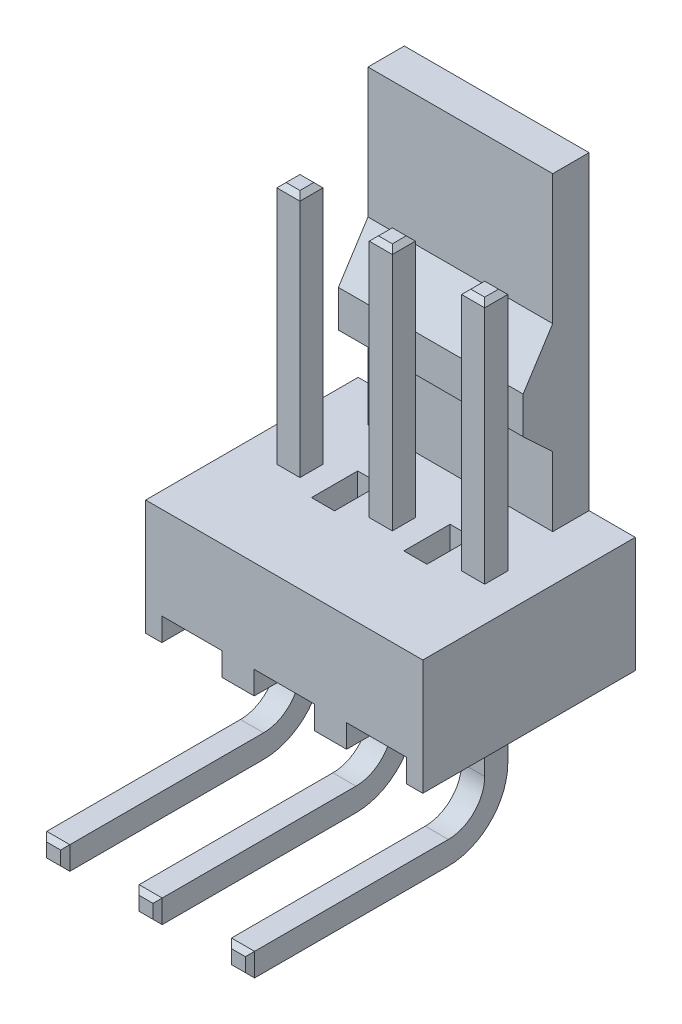
from build123d import *

# Parameters (mm, degrees)
SKETCH1_W            = 6.35
SKETCH1_H            = 5.842
BOSS_EXTRUDE1_DEPTH  = 3.175
BOSS_EXTRUDE2_DEPTH  = 5.08
SKETCH3_W            = 5.842
SKETCH3_H            = 3.175
BOSS_EXTRUDE3_DEPTH  = 1.27
SKETCH4_W            = 1.651
SKETCH4_H            = 0.635
CUT_EXTRUDE1_DEPTH   = 13.284450344
SKETCH5_W            = 0.635
SKETCH5_H            = 0.635
BOSS_EXTRUDE4_DEPTH  = 3.6725
SKETCH6_W            = 0.635
SKETCH6_H            = 0.635
BOSS_EXTRUDE5_DEPTH  = 6.4543
SKETCH7_W            = 1.651
SKETCH7_H            = 0.635
CUT_EXTRUDE2_DEPTH   = 15.482642033
SKETCH8_W            = 0.635
SKETCH8_H            = 0.635
BOSS_EXTRUDE6_DEPTH  = 3.6725
SKETCH9_W            = 0.635
SKETCH9_H            = 0.635
BOSS_EXTRUDE7_DEPTH  = 6.4543
SKETCH10_W           = 1.651
SKETCH10_H           = 0.635
CUT_EXTRUDE3_DEPTH   = 15.482642033
SKETCH11_W           = 0.635
SKETCH11_H           = 0.635
BOSS_EXTRUDE8_DEPTH  = 3.6725
SKETCH12_W           = 0.635
SKETCH12_H           = 0.635
BOSS_EXTRUDE9_DEPTH  = 6.4543
SKETCH13_W           = 0.635
SKETCH13_H           = 0.635
BOSS_EXTRUDE10_DEPTH = 6.71
SKETCH14_W           = 0.635
SKETCH14_H           = 0.635
BOSS_EXTRUDE11_DEPTH = 6.71
SKETCH15_W           = 0.635
SKETCH15_H           = 0.635
BOSS_EXTRUDE12_DEPTH = 6.71
SKETCH16_W           = 0.635
SKETCH16_H           = 1.27
CUT_EXTRUDE4_DEPTH   = 1.27
SKETCH17_W           = 0.635
SKETCH17_H           = 1.27
CUT_EXTRUDE5_DEPTH   = 1.27
CHAMFER1_SIZE        = 0.127
CHAMFER2_SIZE        = 0.753913762
CHAMFER2_SIZE2       = 0.55706549
FILLET1_R            = 1
FILLET2_R            = 1.635


with BuildPart() as part:
    # Sketch1 → Boss-Extrude1 (new body)
    with BuildSketch(Plane.XZ.offset(1.5875)):
        with Locations((-0.635, 0.0508)):
            Rectangle(SKETCH1_W, SKETCH1_H)
    extrude(amount=-BOSS_EXTRUDE1_DEPTH)

    # Sketch2 → Boss-Extrude2 (add)
    with BuildSketch(Plane(origin=(2.54, 0, 0), x_dir=(0, 0, -1), z_dir=(1, 0, 0))):
        Polygon((0.651, 4.6355), (1.8702, 3.4925), (1.8702, 1.5875), (2.8702, 1.5875), (2.8702, 10.1125), (1.8702, 10.1125), (1.8702, 6.5405), align=None)
    extrude(amount=-BOSS_EXTRUDE2_DEPTH)

    # Sketch3 → Boss-Extrude3 (add)
    with BuildSketch(Plane(origin=(2.54, 0, 0), x_dir=(0, 0, -1), z_dir=(1, 0, 0))):
        with Locations((-0.0508, 0)):
            Rectangle(SKETCH3_W, SKETCH3_H)
    extrude(amount=BOSS_EXTRUDE3_DEPTH)

    # Sketch4 → Cut-Extrude1 (cut, through all)
    with BuildSketch(Plane(origin=(0, 0, -2.8702), x_dir=(-1, 0, 0), z_dir=(0, 0, -1))):
        with Locations((0, -1.27)):
            Rectangle(SKETCH4_W, SKETCH4_H)
    extrude(amount=-CUT_EXTRUDE1_DEPTH, mode=Mode.SUBTRACT)

    # Sketch5 → Boss-Extrude4 (add)
    with BuildSketch(Plane.XZ.offset(0.9525)):
        Rectangle(SKETCH5_W, SKETCH5_H)
    extrude(amount=BOSS_EXTRUDE4_DEPTH)

    # Sketch6 → Boss-Extrude5 (add)
    with BuildSketch(Plane.XY.offset(0.3175)):
        with Locations((0, -4.3075)):
            Rectangle(SKETCH6_W, SKETCH6_H)
    extrude(amount=BOSS_EXTRUDE5_DEPTH)

    # Sketch7 → Cut-Extrude2 (cut, through all)
    with BuildSketch(Plane(origin=(0, 0, -2.8702), x_dir=(-1, 0, 0), z_dir=(0, 0, -1))):
        with Locations((2.54, -1.27)):
            Rectangle(SKETCH7_W, SKETCH7_H)
    extrude(amount=-CUT_EXTRUDE2_DEPTH, mode=Mode.SUBTRACT)

    # Sketch8 → Boss-Extrude6 (add)
    with BuildSketch(Plane.XZ.offset(0.9525)):
        with Locations((-2.54, 0)):
            Rectangle(SKETCH8_W, SKETCH8_H)
    extrude(amount=BOSS_EXTRUDE6_DEPTH)

    # Sketch9 → Boss-Extrude7 (add)
    with BuildSketch(Plane.XY.offset(0.3175)):
        with Locations((-2.54, -4.3075)):
            Rectangle(SKETCH9_W, SKETCH9_H)
    extrude(amount=BOSS_EXTRUDE7_DEPTH)

    # Sketch10 → Cut-Extrude3 (cut, through all)
    with BuildSketch(Plane(origin=(0, 0, -2.8702), x_dir=(-1, 0, 0), z_dir=(0, 0, -1))):
        with Locations((-2.54, -1.27)):
            Rectangle(SKETCH10_W, SKETCH10_H)
    extrude(amount=-CUT_EXTRUDE3_DEPTH, mode=Mode.SUBTRACT)

    # Sketch11 → Boss-Extrude8 (add)
    with BuildSketch(Plane.XZ.offset(0.9525)):
        with Locations((2.54, 0)):
            Rectangle(SKETCH11_W, SKETCH11_H)
    extrude(amount=BOSS_EXTRUDE8_DEPTH)

    # Sketch12 → Boss-Extrude9 (add)
    with BuildSketch(Plane.XY.offset(0.3175)):
        with Locations((2.54, -4.3075)):
            Rectangle(SKETCH12_W, SKETCH12_H)
    extrude(amount=BOSS_EXTRUDE9_DEPTH)

    # Sketch13 → Boss-Extrude10 (add)
    with BuildSketch(Plane(origin=(0, 1.5875, 0), x_dir=(-1, 0, 0), z_dir=(0, 1, 0))):
        with Locations((-2.54, 0)):
            Rectangle(SKETCH13_W, SKETCH13_H)
    extrude(amount=BOSS_EXTRUDE10_DEPTH)

    # Sketch14 → Boss-Extrude11 (add)
    with BuildSketch(Plane(origin=(0, 1.5875, 0), x_dir=(-1, 0, 0), z_dir=(0, 1, 0))):
        Rectangle(SKETCH14_W, SKETCH14_H)
    extrude(amount=BOSS_EXTRUDE11_DEPTH)

    # Sketch15 → Boss-Extrude12 (add)
    with BuildSketch(Plane(origin=(0, 1.5875, 0), x_dir=(-1, 0, 0), z_dir=(0, 1, 0))):
        with Locations((2.54, 0)):
            Rectangle(SKETCH15_W, SKETCH15_H)
    extrude(amount=BOSS_EXTRUDE12_DEPTH)

    # Sketch16 → Cut-Extrude4 (cut)
    with BuildSketch(Plane(origin=(0, 1.5875, 0), x_dir=(-1, 0, 0), z_dir=(0, 1, 0))):
        with Locations((-1.27, 0)):
            Rectangle(SKETCH16_W, SKETCH16_H)
    extrude(amount=-CUT_EXTRUDE4_DEPTH, mode=Mode.SUBTRACT)

    # Sketch17 → Cut-Extrude5 (cut)
    with BuildSketch(Plane(origin=(0, 1.5875, 0), x_dir=(-1, 0, 0), z_dir=(0, 1, 0))):
        with Locations((1.27, 0)):
            Rectangle(SKETCH17_W, SKETCH17_H)
    extrude(amount=-CUT_EXTRUDE5_DEPTH, mode=Mode.SUBTRACT)

    # Chamfer1
    chamfer1_edges = [part.edges().sort_by_distance(p)[0] for p in [
        (2.54, -3.99, 6.7718),
        (2.2225, -4.3075, 6.7718),
        (2.8575, -4.3075, 6.7718),
        (2.54, -4.625, 6.7718),
        (-0.3175, -4.3075, 6.7718),
        (0, -3.99, 6.7718),
        (0, -4.625, 6.7718),
        (0.3175, -4.3075, 6.7718),
        (-2.54, 8.2975, -0.3175),
        (-2.8575, 8.2975, 0),
        (-2.2225, 8.2975, 0),
        (-2.54, 8.2975, 0.3175),
        (-2.8575, -4.3075, 6.7718),
        (-2.54, -3.99, 6.7718),
        (-2.54, -4.625, 6.7718),
        (-2.2225, -4.3075, 6.7718),
        (-0.3175, 8.2975, 0),
        (0, 8.2975, -0.3175),
        (0, 8.2975, 0.3175),
        (0.3175, 8.2975, 0),
        (2.8575, 8.2975, 0),
        (2.54, 8.2975, 0.3175),
        (2.54, 8.2975, -0.3175),
        (2.2225, 8.2975, 0),
    ]]
    chamfer(chamfer1_edges, length=CHAMFER1_SIZE)

    # Chamfer2
    chamfer2_edges = [part.edges().sort_by_distance(p)[0] for p in [
        (0, 4.6355, -0.651),
    ]]
    chamfer2_side = [part.faces().sort_by_distance(p)[0] for p in [
        (0, 5.588, -1.2606),
    ]]
    chamfer(chamfer2_edges, length=CHAMFER2_SIZE, length2=CHAMFER2_SIZE2, reference=chamfer2_side[0])

    # Fillet1
    fillet1_edges = [part.edges().sort_by_distance(p)[0] for p in [
        (-2.54, -3.99, 0.3175),
        (0, -3.99, 0.3175),
        (2.54, -3.99, 0.3175),
    ]]
    fillet(fillet1_edges, radius=FILLET1_R)

    # Fillet2
    fillet2_edges = [part.edges().sort_by_distance(p)[0] for p in [
        (2.54, -4.625, -0.3175),
        (-2.54, -4.625, -0.3175),
        (0, -4.625, -0.3175),
    ]]
    fillet(fillet2_edges, radius=FILLET2_R)


solid = part.part
